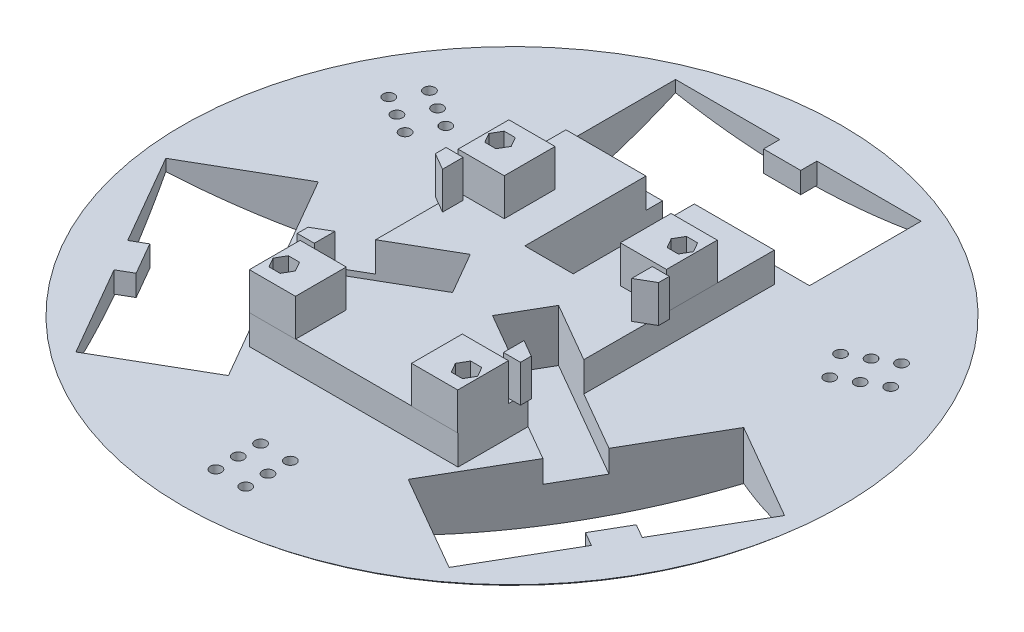
from build123d import *

# Parameters (mm, degrees)
SKETCH2_W           = 66
SKETCH2_H           = 30
CUT_EXTRUDE1_DEPTH  = 40
SKETCH4_W           = 13
SKETCH4_H           = 37
CUT_EXTRUDE2_DEPTH  = 6
BOSS_EXTRUDE1_DEPTH = 8
SKETCH6_W           = 12.402318472
SKETCH6_H           = 13.641488334
SKETCH6_H_2         = 13.641488333
BOSS_EXTRUDE2_DEPTH = 10
BOSS_EXTRUDE3_DEPTH = 10
SKETCH9_W           = 10
SKETCH9_H           = 5.665116272
BOSS_EXTRUDE4_DEPTH = 4.35
CIRPATTERN1_COUNT   = 3
CUT_EXTRUDE3_REACH  = 128.866
SKETCH11_R          = 1.5
CIRPATTERN2_COUNT   = 3


with BuildPart() as part:
    # Sketch3 → Revolve1 (revolve)
    with BuildSketch(Plane(origin=(0, 0, 0), x_dir=(0, 0, -1), z_dir=(1, 0, 0))):
        with BuildLine():
            Line((0, 20), (0, 0))
            ThreePointArc((0, 0), (43.440585665, 3.508757487), (84.753971762, 17.38679738))
            ThreePointArc((84.753971762, 17.38679738), (86.762776598, 18.545504508), (88.56897203, 20))
            Line((88.56897203, 20), (0, 20))
        make_face()
    revolve(axis=Axis((0, 20, 0), (0, -1, 0)))

    # Sketch2 → Cut-Extrude1 (cut)
    with BuildSketch(Plane(origin=(0, 0, 0), x_dir=(1, 0, 0), z_dir=(0, 1, 0))):
        with Locations((0, 61.949465814)):
            Rectangle(SKETCH2_W, SKETCH2_H)
        Polygon((83.140192202, -9.895894582), (50.140192202, -67.053571232), (24.159430089, -52.053571232), (57.159430089, 5.104105418), align=None)
        Polygon((-50.140192202, -67.053571232), (-83.140192202, -9.895894582), (-57.159430089, 5.104105418), (-24.159430089, -52.053571232), align=None)
    extrude(amount=CUT_EXTRUDE1_DEPTH, mode=Mode.SUBTRACT)

    # Sketch4 → Cut-Extrude2 (cut)
    with BuildSketch(Plane(origin=(0, 20, 0), x_dir=(1, 0, 0), z_dir=(0, 1, 0))):
        with Locations((0, 28.449465814)):
            Rectangle(SKETCH4_W, SKETCH4_H)
        Polygon((37.409430089, -29.103898031), (43.909430089, -17.845567782), (11.866490149, 0.654432218), (5.366490149, -10.603898031), align=None)
        Polygon((-43.909430089, -17.845567782), (-37.409430089, -29.103898031), (-5.366490149, -10.603898031), (-11.866490149, 0.654432218), align=None)
    extrude(amount=-CUT_EXTRUDE2_DEPTH, mode=Mode.SUBTRACT)

    # Sketch5 → Boss-Extrude1 (add)
    with BuildSketch(Plane(origin=(0, 20, 0), x_dir=(1, 0, 0), z_dir=(0, 1, 0))):
        Polygon((-28, 42.5), (-6.5, 42.5), (-6.5, 9.949465814), (6.5, 9.949465814), (6.5, 42.5), (28, 42.5), (27.887960119, -8.595567782), (11.866490149, 0.654432218), (5.366490149, -10.603898031), (28, -23.671361037), (28, -42.5), (-28, -42.5), (-28, -23.671361037), (-5.366490149, -10.603898031), (-11.866490149, 0.654432218), (-28, -8.660254038), align=None)
    extrude(amount=BOSS_EXTRUDE1_DEPTH)

    # Sketch6 → Boss-Extrude2 (add)
    # profile 1 of 4: a face of its own
    with BuildSketch(Plane(origin=(0, 28, 0), x_dir=(1, 0, 0), z_dir=(0, 1, 0))):
        with Locations((-21.798840764, 20.339745962)):
            Rectangle(SKETCH6_W, SKETCH6_H)
        Polygon((-21.4977786, 21.28552155), (-22.9988893, 23.88552155), (-26.0011107, 23.88552155), (-27.5022214, 21.28552155), (-26.0011107, 18.68552155), (-22.9988893, 18.68552155), align=None, mode=Mode.SUBTRACT)
    # profile 2 of 4: a face of its own
    with BuildSketch(Plane(origin=(0, 28, 0), x_dir=(1, 0, 0), z_dir=(0, 1, 0))):
        with Locations((21.798840764, 20.339745962)):
            Rectangle(SKETCH6_W, SKETCH6_H)
        Polygon((21.4977786, 21.28552155), (22.9988893, 23.88552155), (26.0011107, 23.88552155), (27.5022214, 21.28552155), (26.0011107, 18.68552155), (22.9988893, 18.68552155), align=None, mode=Mode.SUBTRACT)
    # profile 3 of 4: a face of its own
    with BuildSketch(Plane(origin=(0, 28, 0), x_dir=(1, 0, 0), z_dir=(0, 1, 0))):
        with Locations((21.798840764, -35.768702862)):
            Rectangle(SKETCH6_W, SKETCH6_H_2)
        Polygon((26.0011107, -39.31447845), (27.5022214, -36.71447845), (26.0011107, -34.11447845), (22.9988893, -34.11447845), (21.4977786, -36.71447845), (22.9988893, -39.31447845), align=None, mode=Mode.SUBTRACT)
    # profile 4 of 4: a face of its own
    with BuildSketch(Plane(origin=(0, 28, 0), x_dir=(1, 0, 0), z_dir=(0, 1, 0))):
        with Locations((-21.798840764, -35.768702862)):
            Rectangle(SKETCH6_W, SKETCH6_H_2)
        Polygon((-21.4977786, -36.71447845), (-22.9988893, -39.31447845), (-26.0011107, -39.31447845), (-27.5022214, -36.71447845), (-26.0011107, -34.11447845), (-22.9988893, -34.11447845), align=None, mode=Mode.SUBTRACT)
    extrude(amount=BOSS_EXTRUDE2_DEPTH)

    # Sketch8 → Boss-Extrude3 (add)
    with BuildSketch(Plane(origin=(0, 28, 0), x_dir=(1, 0, 0), z_dir=(0, 1, 0))):
        Polygon((-25.413351143, -22.177958623), (-30, -24.826061575), (-30, -27.71447845), (-25.413351143, -27.71447845), align=None)
        Polygon((25.413351143, -27.71447845), (30, -27.71447845), (30, -24.826061575), (25.413351143, -22.177958623), align=None)
        Polygon((-30, 12.28552155), (-30, 9.397104676), (-25.413351143, 6.749001724), (-25.413351143, 12.28552155), align=None)
        Polygon((30, 9.397104676), (30, 12.28552155), (25.413351143, 12.28552155), (25.413351143, 6.749001724), align=None)
    extrude(amount=BOSS_EXTRUDE3_DEPTH)

    # Sketch9 → Boss-Extrude4 (add)
    with BuildSketch(Plane.XY.offset(-76.949465814)):
        with Locations((0, 17.167441864)):
            Rectangle(SKETCH9_W, SKETCH9_H)
    boss_extrude4 = extrude(amount=BOSS_EXTRUDE4_DEPTH)

    # CirPattern1: Boss-Extrude4 ×3 about axis
    cirpattern1_axis = Axis((0, 20, 0), (0, 1, 0))
    for i in range(1, CIRPATTERN1_COUNT):
        add(boss_extrude4.rotate(cirpattern1_axis, i * 360 / CIRPATTERN1_COUNT))

    # Sketch11 → Cut-Extrude3 (cut, up to next)
    with BuildSketch(Plane(origin=(0, 20, 0), x_dir=(1, 0, 0), z_dir=(0, 1, 0)), mode=Mode.PRIVATE) as cut_extrude3_sk1:
        with Locations((-4, -69.56897203)):
            Circle(SKETCH11_R)
    cut_extrude3_tool1 = extrude(cut_extrude3_sk1.sketch, amount=-CUT_EXTRUDE3_REACH, mode=Mode.PRIVATE) & part.part
    # Sketch11 → Cut-Extrude3 (cut, up to next)
    with BuildSketch(Plane(origin=(0, 20, 0), x_dir=(1, 0, 0), z_dir=(0, 1, 0)), mode=Mode.PRIVATE) as cut_extrude3_sk2:
        with Locations((-4, -75.56897203)):
            Circle(SKETCH11_R)
    cut_extrude3_tool2 = extrude(cut_extrude3_sk2.sketch, amount=-CUT_EXTRUDE3_REACH, mode=Mode.PRIVATE) & part.part
    # Sketch11 → Cut-Extrude3 (cut, up to next)
    with BuildSketch(Plane(origin=(0, 20, 0), x_dir=(1, 0, 0), z_dir=(0, 1, 0)), mode=Mode.PRIVATE) as cut_extrude3_sk3:
        with Locations((4, -75.56897203)):
            Circle(SKETCH11_R)
    cut_extrude3_tool3 = extrude(cut_extrude3_sk3.sketch, amount=-CUT_EXTRUDE3_REACH, mode=Mode.PRIVATE) & part.part
    # Sketch11 → Cut-Extrude3 (cut, up to next)
    with BuildSketch(Plane(origin=(0, 20, 0), x_dir=(1, 0, 0), z_dir=(0, 1, 0)), mode=Mode.PRIVATE) as cut_extrude3_sk4:
        with Locations((4, -69.56897203)):
            Circle(SKETCH11_R)
    cut_extrude3_tool4 = extrude(cut_extrude3_sk4.sketch, amount=-CUT_EXTRUDE3_REACH, mode=Mode.PRIVATE) & part.part
    # Sketch11 → Cut-Extrude3 (cut, up to next)
    with BuildSketch(Plane(origin=(0, 20, 0), x_dir=(1, 0, 0), z_dir=(0, 1, 0)), mode=Mode.PRIVATE) as cut_extrude3_sk5:
        with Locations((-4, -63.56897203)):
            Circle(SKETCH11_R)
    cut_extrude3_tool5 = extrude(cut_extrude3_sk5.sketch, amount=-CUT_EXTRUDE3_REACH, mode=Mode.PRIVATE) & part.part
    # Sketch11 → Cut-Extrude3 (cut, up to next)
    with BuildSketch(Plane(origin=(0, 20, 0), x_dir=(1, 0, 0), z_dir=(0, 1, 0)), mode=Mode.PRIVATE) as cut_extrude3_sk6:
        with Locations((4, -63.56897203)):
            Circle(SKETCH11_R)
    cut_extrude3_tool6 = extrude(cut_extrude3_sk6.sketch, amount=-CUT_EXTRUDE3_REACH, mode=Mode.PRIVATE) & part.part
    cut_extrude3_1 = cut_extrude3_tool1.solids().sort_by_distance((-4, 20, 69.568972))[0]
    add(cut_extrude3_1, mode=Mode.SUBTRACT)
    cut_extrude3_2 = cut_extrude3_tool2.solids().sort_by_distance((-4, 20, 75.568972))[0]
    add(cut_extrude3_2, mode=Mode.SUBTRACT)
    cut_extrude3_3 = cut_extrude3_tool3.solids().sort_by_distance((4, 20, 75.568972))[0]
    add(cut_extrude3_3, mode=Mode.SUBTRACT)
    cut_extrude3_4 = cut_extrude3_tool4.solids().sort_by_distance((4, 20, 69.568972))[0]
    add(cut_extrude3_4, mode=Mode.SUBTRACT)
    cut_extrude3_5 = cut_extrude3_tool5.solids().sort_by_distance((-4, 20, 63.568972))[0]
    add(cut_extrude3_5, mode=Mode.SUBTRACT)
    cut_extrude3_6 = cut_extrude3_tool6.solids().sort_by_distance((4, 20, 63.568972))[0]
    add(cut_extrude3_6, mode=Mode.SUBTRACT)
    cut_extrude3 = cut_extrude3_1 + cut_extrude3_2 + cut_extrude3_3 + cut_extrude3_4 + cut_extrude3_5 + cut_extrude3_6  # Cut-Extrude3 as one shape, for the pattern or mirror that repeats it

    # CirPattern2: Cut-Extrude3 ×3 about axis
    cirpattern2_axis = Axis((0, 20, 0), (0, 1, 0))
    for i in range(1, CIRPATTERN2_COUNT):
        add(cut_extrude3.rotate(cirpattern2_axis, i * 360 / CIRPATTERN2_COUNT), mode=Mode.SUBTRACT)


solid = part.part
